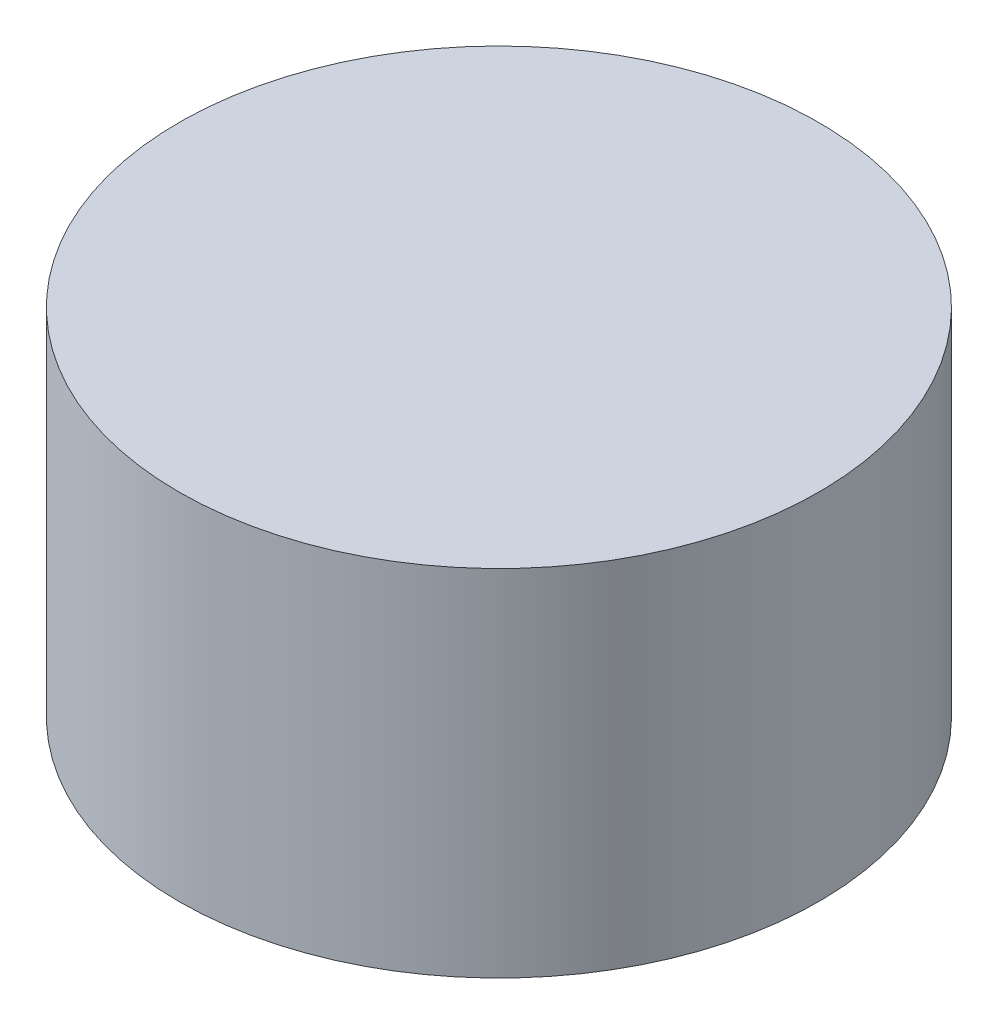
from build123d import *

# Parameters (mm, degrees)
SKETCH1_R           = 64.964891119
BOSS_EXTRUDE1_DEPTH = 72


with BuildPart() as part:
    # Sketch1 → Boss-Extrude1 (new body)
    with BuildSketch(Plane(origin=(0, 0, 0), x_dir=(1, 0, 0), z_dir=(0, 1, 0))):
        Circle(SKETCH1_R)
    extrude(amount=BOSS_EXTRUDE1_DEPTH)


solid = part.part
